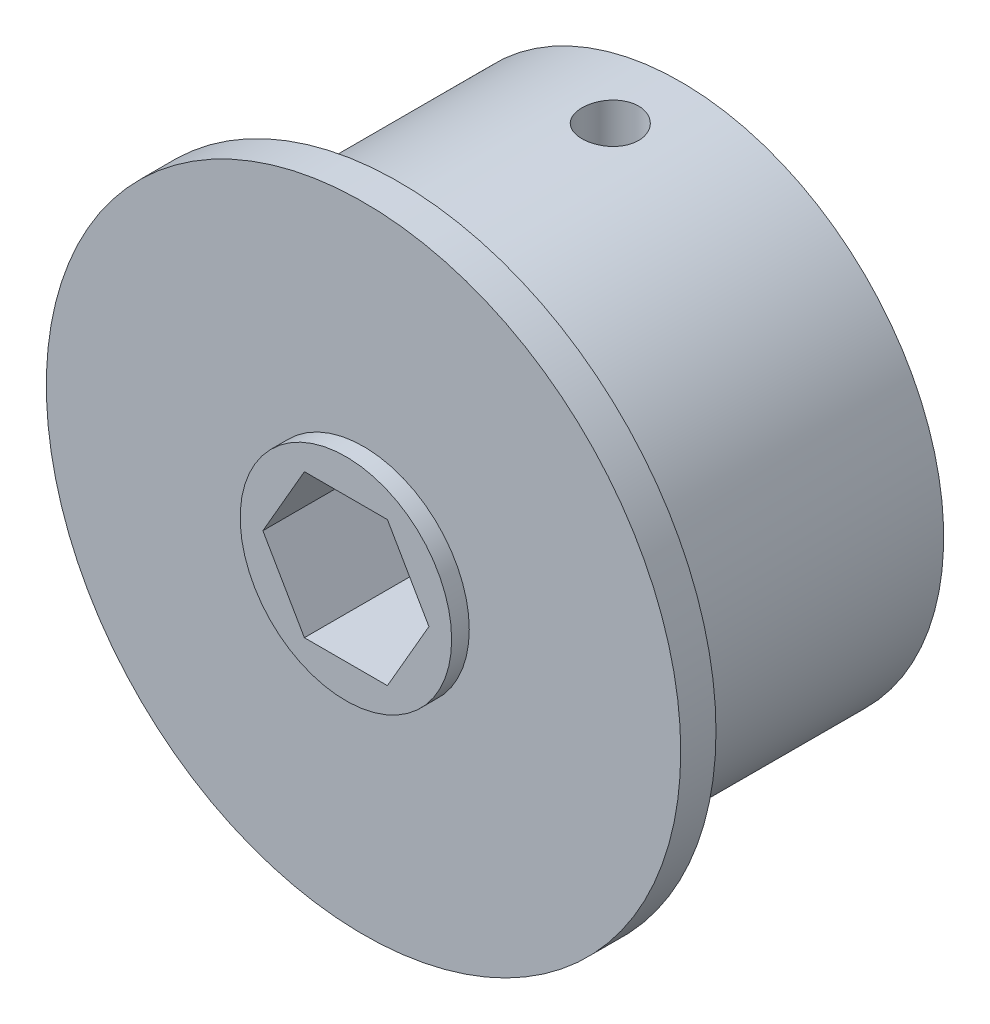
from build123d import *

# Parameters (mm, degrees)
SKETCH1_R               = 23.6855
BOSS_EXTRUDE1_DEPTH     = 12.7
SKETCH2_R               = 28.575
BOSS_EXTRUDE2_DEPTH     = 3.175
BOSS_EXTRUDE3_START     = 12.7
SKETCH3_R               = 23.6855
BOSS_EXTRUDE3_DEPTH     = 12.7
CUT_EXTRUDE1_DEPTH      = 44.417472001
CUT_EXTRUDE1_DEPTH_BACK = 44.417472001
SKETCH4_R               = 2.5527
SKETCH5_R               = 9.525
BOSS_EXTRUDE4_DEPTH     = 1.5875


with BuildPart() as part:
    # Sketch1 → Boss-Extrude1 (new body)
    with BuildSketch(Plane.XY):
        Circle(SKETCH1_R)
        Polygon((7.478995387, 0), (3.739497694, 6.477), (-3.739497694, 6.477), (-7.478995387, 0), (-3.739497694, -6.477), (3.739497694, -6.477), align=None, mode=Mode.SUBTRACT)
    extrude(amount=BOSS_EXTRUDE1_DEPTH)

    # Sketch2 → Boss-Extrude2 (add)
    with BuildSketch(Plane.XY.offset(12.7)):
        Circle(SKETCH2_R)
        Polygon((7.478995387, 0), (3.739497694, 6.477), (-3.739497694, 6.477), (-7.478995387, 0), (-3.739497694, -6.477), (3.739497694, -6.477), align=None, mode=Mode.SUBTRACT)
    extrude(amount=BOSS_EXTRUDE2_DEPTH)

    # Sketch3 → Boss-Extrude3 (add)
    with BuildSketch(Plane(origin=(0, 0, 0), x_dir=(-1, 0, 0), z_dir=(0, 0, -1)).offset(BOSS_EXTRUDE3_START)):
        Circle(SKETCH3_R)
    extrude(amount=-BOSS_EXTRUDE3_DEPTH)

    # Sketch4 → Cut-Extrude1 (cut, two sides: drawn at the far end of the back side and taken through both)
    with BuildSketch(Plane(origin=(0, 0, 0), x_dir=(1, 0, 0), z_dir=(0, 1, 0)).offset(-CUT_EXTRUDE1_DEPTH_BACK)):
        with Locations((0, 6.35)):
            Circle(SKETCH4_R)
    extrude(amount=CUT_EXTRUDE1_DEPTH + CUT_EXTRUDE1_DEPTH_BACK, mode=Mode.SUBTRACT)

    # Sketch5 → Boss-Extrude4 (add)
    with BuildSketch(Plane.XY.offset(15.875)):
        Circle(SKETCH5_R)
        Polygon((7.478995387, 0), (3.739497694, 6.477), (-3.739497694, 6.477), (-7.478995387, 0), (-3.739497694, -6.477), (3.739497694, -6.477), align=None, mode=Mode.SUBTRACT)
    extrude(amount=BOSS_EXTRUDE4_DEPTH)


solid = part.part
